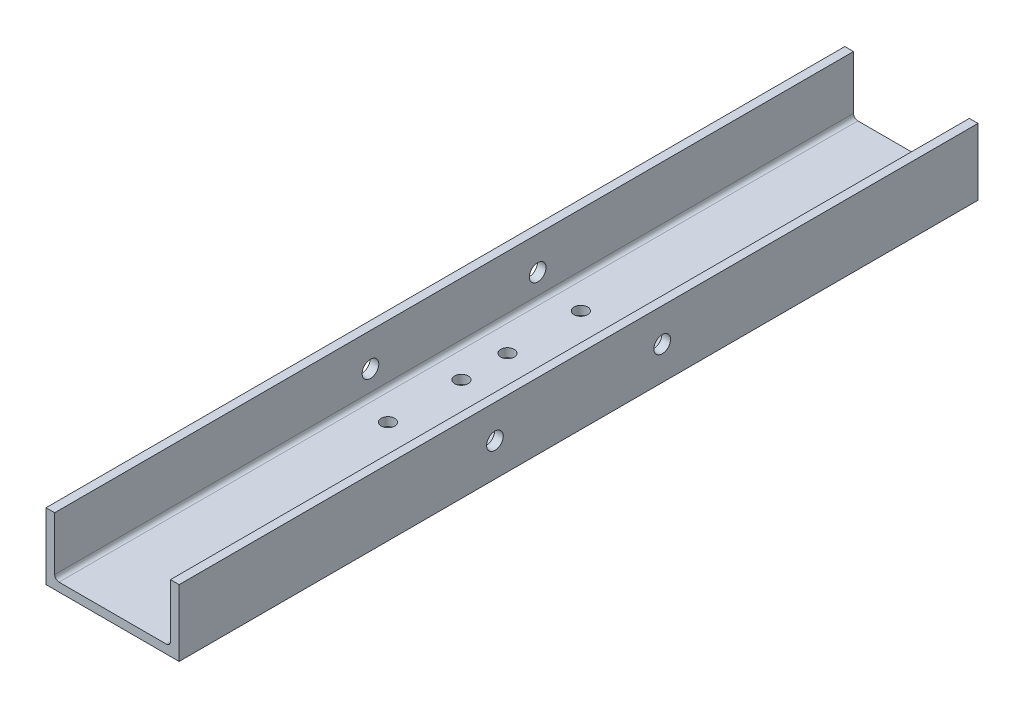
from build123d import *

# Parameters (mm, degrees)
BOSS_EXTRUDE1_DEPTH = 152.4
FILLET1_R           = 1.651
SKETCH4_R           = 2.585
CUT_EXTRUDE1_DEPTH  = 10
SKETCH9_R           = 3.18
CUT_EXTRUDE2_DEPTH  = 30


with BuildPart() as part:
    # Sketch3 → Boss-Extrude1 (new, symmetric)
    with BuildSketch(Plane.XY):
        Polygon((-25.4, 12.7), (-25.4, -12.7), (25.4, -12.7), (25.4, 12.7), (22.098, 12.7), (22.098, -9.398), (-22.098, -9.398), (-22.098, 12.7), align=None)
    extrude(amount=BOSS_EXTRUDE1_DEPTH, both=True)

    # Fillet1
    fillet1_edges = [part.edges().sort_by_distance(p)[0] for p in [
        (22.098, -9.398, 0),
        (-22.098, -9.398, 0),
    ]]
    fillet(fillet1_edges, radius=FILLET1_R)

    # Sketch4 → Cut-Extrude1 (cut)
    with BuildSketch(Plane(origin=(0, -9.398, 0), x_dir=(1, 0, 0), z_dir=(0, 1, 0))):
        with Locations((-10.530435142, 8.79)):
            Circle(SKETCH4_R)
        with Locations((10.469564858, 8.79)):
            Circle(SKETCH4_R)
        with Locations((-10.530435142, 36.79)):
            Circle(SKETCH4_R)
        with Locations((10.469564858, 36.79)):
            Circle(SKETCH4_R)
        with Locations((-10.530435142, -36.79)):
            Circle(SKETCH4_R)
        with Locations((10.469564858, -36.79)):
            Circle(SKETCH4_R)
        with Locations((10.469564858, -8.79)):
            Circle(SKETCH4_R)
        with Locations((-10.530435142, -8.79)):
            Circle(SKETCH4_R)
    extrude(amount=-CUT_EXTRUDE1_DEPTH, mode=Mode.SUBTRACT)

    # Sketch9 → Cut-Extrude2 (cut, symmetric)
    with BuildSketch(Plane(origin=(0, 0, 0), x_dir=(0, 0, -1), z_dir=(1, 0, 0))):
        with Locations((-31.91, 0)):
            Circle(SKETCH9_R)
        with Locations((31.91, 0)):
            Circle(SKETCH9_R)
    extrude(amount=CUT_EXTRUDE2_DEPTH, both=True, mode=Mode.SUBTRACT)


solid = part.part
